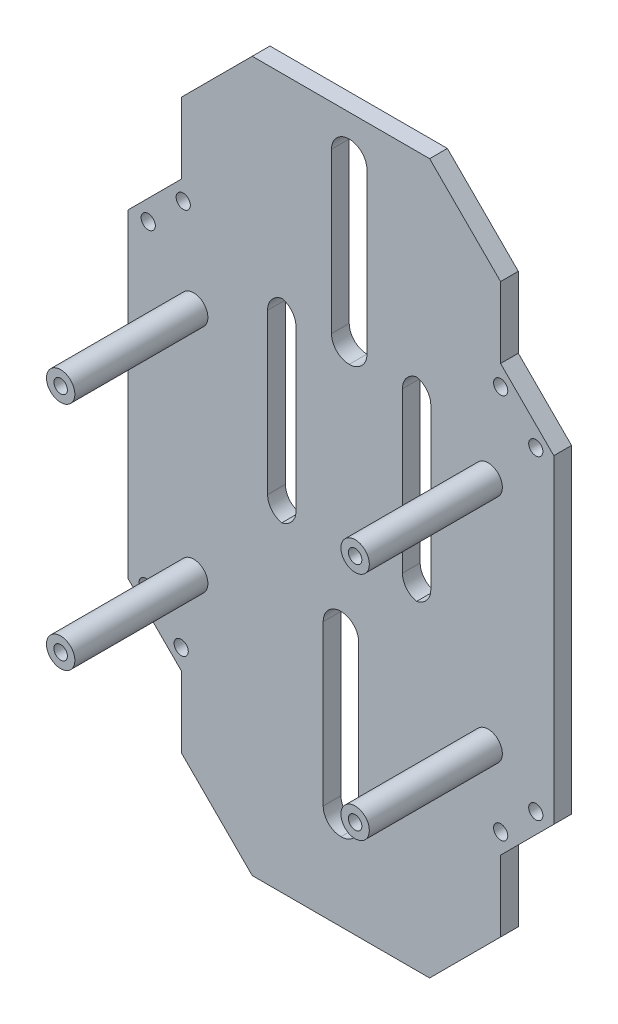
from build123d import *

# Parameters (mm, degrees)
ESQUISSE1_W             = 120
ESQUISSE1_H             = 120
BOSS_EXTRU_2_DEPTH      = 5
ESQUISSE9_R             = 4
BOSS_EXTRU_4_DEPTH      = 37.5
CHANFREIN5_SIZE         = 15
CHANFREIN6_SIZE         = 15
CHANFREIN7_SIZE         = 15
CHANFREIN8_SIZE         = 15
D_GAGEMENT_61_D         = 3.7973
D_GAGEMENT_61_DEPTH     = 10
D_GAGEMENT_61_TIP       = 1.140824014
ESQUISSE21_W            = 90
ESQUISSE21_H            = 5
BOSS_EXTRU_7_DEPTH      = 40
ESQUISSE22_W            = 90
ESQUISSE22_H            = 5
BOSS_EXTRU_8_DEPTH      = 40
CHANFREIN23_SIZE        = 20
ESQUISSE23_R            = 2
ENL_V_MAT_EXTRU_1_DEPTH = 10
SKETCH1_W               = 10
SKETCH1_H               = 55
CUT_EXTRUDE2_DEPTH      = 5
FILLET2_R               = 5
FILLET3_R               = 5
SKETCH3_W               = 10
SKETCH3_H               = 55
CUT_EXTRUDE4_DEPTH      = 5
FILLET11_R              = 5
SKETCH4_W               = 8
SKETCH4_H               = 55
CUT_EXTRUDE5_DEPTH      = 5
FILLET12_R              = 5
SKETCH4_2_W             = 8
SKETCH4_2_H             = 55
CUT_EXTRUDE6_DEPTH      = 5
FILLET16_R              = 5
FILLET17_R              = 5


# Some blends are built 0.0001 mm under size
with BuildPart() as part:
    # Esquisse1 → Boss.-Extru.2 (new body)
    with BuildSketch(Plane.XY):
        with Locations((18.92806479, -29.794391972)):
            Rectangle(ESQUISSE1_W, ESQUISSE1_H)
    extrude(amount=BOSS_EXTRU_2_DEPTH)

    # Esquisse9 → Boss.-Extru.4 (add)
    with BuildSketch(Plane.XY.offset(5)):
        with Locations(Location((-22.57193521, -64.794391972, 0), (0, 0, 180))):
            Circle(ESQUISSE9_R)
        with Locations(Location((-22.57193521, 0.205608028, 0), (0, 0, 180))):
            Circle(ESQUISSE9_R)
        with Locations(Location((60.42806479, 0.205608028, 0), (0, 0, 180))):
            Circle(ESQUISSE9_R)
        with Locations(Location((60.42806479, -64.794391972, 0), (0, 0, 180))):
            Circle(ESQUISSE9_R)
    extrude(amount=BOSS_EXTRU_4_DEPTH)

    # Chanfrein5
    chanfrein5_edges = [part.edges().sort_by_distance(p)[0] for p in [
        (78.92806479, -89.794391972, 2.5),
    ]]
    chamfer(chanfrein5_edges, length=CHANFREIN5_SIZE)

    # Chanfrein6
    chanfrein6_edges = [part.edges().sort_by_distance(p)[0] for p in [
        (78.92806479, 30.205608028, 2.5),
    ]]
    chamfer(chanfrein6_edges, length=CHANFREIN6_SIZE)

    # Chanfrein7
    chanfrein7_edges = [part.edges().sort_by_distance(p)[0] for p in [
        (-41.07193521, 30.205608028, 2.5),
    ]]
    chamfer(chanfrein7_edges, length=CHANFREIN7_SIZE)

    # Chanfrein8
    chanfrein8_edges = [part.edges().sort_by_distance(p)[0] for p in [
        (-41.07193521, -89.794391972, 2.5),
    ]]
    chamfer(chanfrein8_edges, length=CHANFREIN8_SIZE)

    # Dégagement #61
    with Locations(Plane(origin=(-22.57193521, -64.794391972, 42.5), x_dir=(1, 0, 0), z_dir=(0, 0, 1))):
        with Locations((0, 0), (83, 0), (83, 65), (0, 65)):
            Hole(D_GAGEMENT_61_D / 2, depth=D_GAGEMENT_61_DEPTH)
            with Locations((0, 0, -(D_GAGEMENT_61_DEPTH + D_GAGEMENT_61_TIP / 2))):  # 118° drill point
                Cone(0, D_GAGEMENT_61_D / 2, D_GAGEMENT_61_TIP, mode=Mode.SUBTRACT)

    # Esquisse21 → Boss.-Extru.7 (add)
    with BuildSketch(Plane(origin=(0, -89.794391972, 0), x_dir=(-1, 0, 0), z_dir=(0, -1, 0))):
        with Locations((-18.92806479, -2.5)):
            Rectangle(ESQUISSE21_W, ESQUISSE21_H)
    extrude(amount=BOSS_EXTRU_7_DEPTH)

    # Esquisse22 → Boss.-Extru.8 (add)
    with BuildSketch(Plane(origin=(0, 30.205608028, 0), x_dir=(1, 0, 0), z_dir=(0, 1, 0))):
        with Locations((18.92806479, -2.5)):
            Rectangle(ESQUISSE22_W, ESQUISSE22_H)
    extrude(amount=BOSS_EXTRU_8_DEPTH)

    # Chanfrein23
    chanfrein23_edges = [part.edges().sort_by_distance(p)[0] for p in [
        (-26.07193521, -129.794391972, 2.5),
        (63.92806479, -129.794391972, 2.5),
        (63.92806479, 70.205608028, 2.5),
        (-26.07193521, 70.205608028, 2.5),
    ]]
    chamfer(chanfrein23_edges, length=CHANFREIN23_SIZE)

    # Esquisse23 → Enlèv. mat.-Extru.1 (cut)
    with BuildSketch(Plane.XY.offset(5)):
        with Locations((-35.996277988, -74.213194945)):
            Circle(ESQUISSE23_R)
        with Locations((-26.096783051, -84.112689881)):
            Circle(ESQUISSE23_R)
        with Locations((-25.52408096, 25.096608028)):
            Circle(ESQUISSE23_R)
        with Locations((-35.390089468, 15.163739554)):
            Circle(ESQUISSE23_R)
        with Locations((63.953155144, 24.523663425)):
            Circle(ESQUISSE23_R)
        with Locations((73.85265008, 14.624168488)):
            Circle(ESQUISSE23_R)
        with Locations((63.953210541, -84.112391972)):
            Circle(ESQUISSE23_R)
        with Locations((73.852705477, -74.212897035)):
            Circle(ESQUISSE23_R)
    extrude(amount=-ENL_V_MAT_EXTRU_1_DEPTH, mode=Mode.SUBTRACT)

    # Sketch1 → Cut-Extrude2 (cut)
    with BuildSketch(Plane.XY.offset(5)):
        with Locations((18.92806479, -80.294391972)):
            Rectangle(SKETCH1_W, SKETCH1_H)
    extrude(amount=-CUT_EXTRUDE2_DEPTH, mode=Mode.SUBTRACT)

    # Fillet2
    fillet2_edges = [part.edges().sort_by_distance(p)[0] for p in [
        (13.92806479, -107.794391972, 2.5),
    ]]
    fillet(fillet2_edges, radius=FILLET2_R)

    # Fillet3
    fillet3_edges = [part.edges().sort_by_distance(p)[0] for p in [
        (13.92806479, -52.794391972, 2.5),
        (23.92806479, -52.794391972, 2.5),
        (23.92806479, -107.794391972, 2.5),
    ]]
    fillet(fillet3_edges, radius=FILLET3_R - 0.0001)  # a hair under: the kernel refuses the full size

    # Sketch3 → Cut-Extrude4 (cut)
    with BuildSketch(Plane.XY.offset(5)):
        with Locations((21.260912997, 36.166130895)):
            Rectangle(SKETCH3_W, SKETCH3_H)
    extrude(amount=-CUT_EXTRUDE4_DEPTH, mode=Mode.SUBTRACT)

    # Fillet11
    fillet11_edges = [part.edges().sort_by_distance(p)[0] for p in [
        (16.260912997, 63.666130895, 2.5),
        (26.260912997, 63.666130895, 2.5),
        (26.260912997, 8.666130895, 2.5),
        (16.260912997, 8.666130895, 2.5),
    ]]
    fillet(fillet11_edges, radius=FILLET11_R - 0.0001)  # a hair under: the kernel refuses the full size

    # Sketch4 → Cut-Extrude5 (cut)
    with BuildSketch(Plane.XY.offset(5)):
        with Locations((2.260912997, -12.123457497)):
            Rectangle(SKETCH4_W, SKETCH4_H)
        with Locations((40.260912997, -12.294391972)):
            Rectangle(SKETCH4_W, SKETCH4_H)
    extrude(amount=-CUT_EXTRUDE5_DEPTH, mode=Mode.SUBTRACT)

    # Fillet12
    # the kernel refuses this fillet: 5 mm, written as the material it adds along each edge
    with BuildSketch(Plane(origin=(44.260912997, 15.205608028, 5), x_dir=(0, -1, 0), z_dir=(0, 0, -1))) as fillet12_piece_1:
        with BuildLine():
            CenterArc((FILLET12_R, FILLET12_R), FILLET12_R, 180, 90)
            Line((0, FILLET12_R), (0, 0))
            Line((0, 0), (FILLET12_R, 0))
        make_face()
    extrude(amount=5)
    with BuildSketch(Plane(origin=(44.260912997, -39.794391972, 5), x_dir=(0, 1, 0), z_dir=(0, 0, -1)), Plane(origin=(36.260912997, 15.205608028, 5), x_dir=(0, -1, 0), z_dir=(0, 0, -1)), Plane(origin=(36.260912997, -39.794391972, 5), x_dir=(1, 0, 0), z_dir=(0, 0, -1))) as fillet12_piece_2:
        with BuildLine():
            CenterArc((FILLET12_R, -FILLET12_R), FILLET12_R, 90, 90)
            Line((0, -FILLET12_R), (0, 0))
            Line((0, 0), (FILLET12_R, 0))
        make_face()
    extrude(amount=5)

    # Sketch4<2> → Cut-Extrude6 (cut)
    with BuildSketch(Plane.XY.offset(5)):
        with Locations((2.260912997, -12.123457497)):
            Rectangle(SKETCH4_2_W, SKETCH4_2_H)
        with Locations((40.260912997, -12.294391972)):
            Rectangle(SKETCH4_2_W, SKETCH4_2_H)
    extrude(amount=-CUT_EXTRUDE6_DEPTH, mode=Mode.SUBTRACT)

    # Fillet16
    # the kernel refuses this fillet: 5 mm, written as the material it adds along each edge
    with BuildSketch(Plane(origin=(6.260912997, -39.623457497, 5), x_dir=(-1, 0, 0), z_dir=(0, 0, -1)), Plane(origin=(-1.739087003, 15.376542503, 5), x_dir=(1, 0, 0), z_dir=(0, 0, -1)), Plane(origin=(-1.739087003, -39.623457497, 5), x_dir=(0, 1, 0), z_dir=(0, 0, -1))) as fillet16_piece_1:
        with BuildLine():
            CenterArc((FILLET16_R, FILLET16_R), FILLET16_R, 180, 90)
            Line((0, FILLET16_R), (0, 0))
            Line((0, 0), (FILLET16_R, 0))
        make_face()
    extrude(amount=5)
    with BuildSketch(Plane(origin=(6.260912997, 15.376542503, 5), x_dir=(-1, 0, 0), z_dir=(0, 0, -1))) as fillet16_piece_2:
        with BuildLine():
            CenterArc((FILLET16_R, -FILLET16_R), FILLET16_R, 90, 90)
            Line((0, -FILLET16_R), (0, 0))
            Line((0, 0), (FILLET16_R, 0))
        make_face()
    extrude(amount=5)

    # Fillet17
    # the kernel refuses this fillet: 5 mm, written as the material it adds along each edge
    with BuildSketch(Plane(origin=(36.260912997, 15.205608028, 5), x_dir=(1, 0, 0), z_dir=(0, 0, -1)), Plane(origin=(36.260912997, -39.794391972, 5), x_dir=(0, 1, 0), z_dir=(0, 0, -1))) as fillet17_piece_1:
        with BuildLine():
            CenterArc((FILLET17_R, FILLET17_R), FILLET17_R, 180, 90)
            Line((0, FILLET17_R), (0, 0))
            Line((0, 0), (FILLET17_R, 0))
        make_face()
    extrude(amount=5)
    with BuildSketch(Plane(origin=(44.260912997, 15.205608028, 5), x_dir=(-1, 0, 0), z_dir=(0, 0, -1)), Plane(origin=(44.260912997, -39.794391972, 5), x_dir=(0, 1, 0), z_dir=(0, 0, -1))) as fillet17_piece_2:
        with BuildLine():
            CenterArc((FILLET17_R, -FILLET17_R), FILLET17_R, 90, 90)
            Line((0, -FILLET17_R), (0, 0))
            Line((0, 0), (FILLET17_R, 0))
        make_face()
    extrude(amount=5)


solid = part.part
